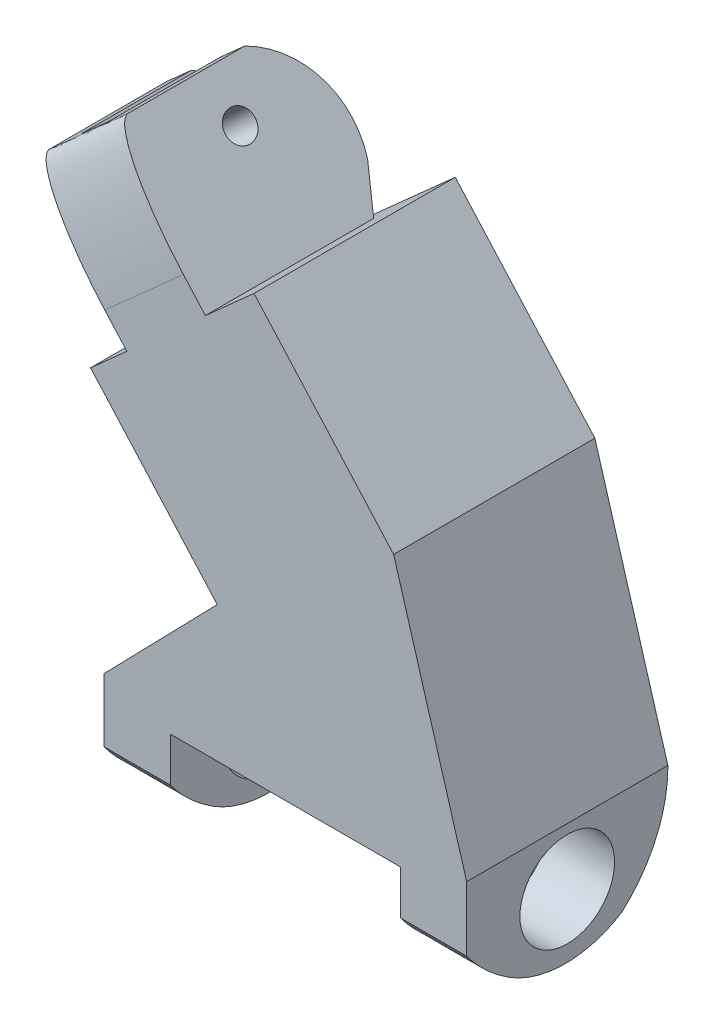
from build123d import *

# Parameters (mm, degrees)
BOSS_EXTRUDE1_DEPTH           = 17
CUT_EXTRUDE2_DEPTH            = 35
CUT_EXTRUDE3_DEPTH            = 30.5
CUT_EXTRUDE4_DEPTH            = 61
SKETCH6_R                     = 4
CUT_EXTRUDE5_DEPTH            = 61
CUT_EXTRUDE6_START            = -12.79
SKETCH7_W                     = 3.3
SKETCH7_H                     = 14.201279548
CUT_EXTRUDE6_DEPTH            = 12.79
SKETCH8_R                     = 1.25
CUT_EXTRUDE7_DEPTH            = 61
SKETCH9_R                     = 2.25
SKETCH9_R_2                   = 1.25
EXTRUDE_THIN1_DEPTH           = 1.75
EXTRUDE_THIN1_TAPER           = -30
EXTRUDE_THIN1_OTHER_WAY_DEPTH = 1.75
EXTRUDE_THIN1_OTHER_WAY_TAPER = -30
SKETCH10_R                    = 1.25
CUT_EXTRUDE9_DEPTH            = 43.000727623
FILLET1_SIZE                  = 10
FILLET1_SIZE_2                = 2


with BuildPart() as part:
    # Sketch1 → Boss-Extrude1 (new body)
    with BuildSketch(Plane.XY):
        Polygon((0, 0), (-11.797217655, 13.195289144), (-15.907217655, 9.520753176), (-24.431873803, 19.055654202), (-31.066793203, 13.123719901), (-22.542137055, 3.588818875), (-25.606127924, 0.849464945), (-14.904077823, -11.120869896), (-24.464229858, -20.947751043), (-24.464229858, -31.437751043), (-18.864229858, -31.437751043), (-18.864229858, -22.577751043), (0.565770142, -22.577751043), (0.565770142, -31.437751043), (6.165770142, -31.437751043), (6.165770142, -20.857751043), align=None)
    extrude(amount=BOSS_EXTRUDE1_DEPTH)

    # Sketch3 → Cut-Extrude2 (cut)
    with BuildSketch(Plane(origin=(-4.11, -3.674535968, 0), x_dir=(0, 0, -1), z_dir=(0.7454965618132088, 0.6665094720442348, 0))):
        with BuildLine():
            Line((-1.11054508, 20.98073524), (-2.78, 17.7))
            Line((-2.78, 17.7), (0.68, 17.7))
            Line((0.68, 17.7), (0.68, 32.569121824))
            Line((0.68, 32.569121824), (-17, 32.569121824))
            Line((-17, 32.569121824), (-17, 30.49))
            Line((-17, 30.49), (-5.15, 30.49))
            ThreePointArc((-5.15, 30.49), (-1.285745078, 26.518907223), (-1.11054508, 20.98073524))
        make_face()
    extrude(amount=-CUT_EXTRUDE2_DEPTH, mode=Mode.SUBTRACT)

    # Sketch4 → Cut-Extrude3 (cut, symmetric)
    with BuildSketch(Plane(origin=(-18.864229858, 0, 0), x_dir=(0, 0, -1), z_dir=(1, 0, 0))):
        with BuildLine():
            Line((-17, -26.307751043), (-17, -22.577751043))
            Line((-17, -22.577751043), (-18.338911285, -22.577751043))
            Line((-18.338911285, -22.577751043), (-18.338911285, -32.309712135))
            Line((-18.338911285, -32.309712135), (1.137649959, -32.309712135))
            Line((1.137649959, -32.309712135), (1.137649959, -22.577751043))
            Line((1.137649959, -22.577751043), (0, -22.577751043))
            Line((0, -22.577751043), (0, -29.657751043))
            Line((0, -29.657751043), (-3.9, -29.657751043))
            ThreePointArc((-3.9, -29.657751043), (-8.65, -31.031297694), (-13.4, -29.657751043))
            add(Edge.make_bspline(
                [(-13.4, -29.657751043), (-15.541480272, -28.298487281), (-17, -26.307751043)],
                knots=[0, 0, 0, 1, 1, 1], degree=2))
        make_face()
    extrude(amount=CUT_EXTRUDE3_DEPTH, both=True, mode=Mode.SUBTRACT)

    # Sketch5 → Cut-Extrude4 (cut)
    with BuildSketch(Plane.ZY.offset(-0.565770142)):
        with BuildLine():
            Line((3.9, -29.657751043), (0, -29.657751043))
            Line((0, -29.657751043), (0, -20.947751043))
            ThreePointArc((0, -20.947751043), (1.01950945, -25.719388602), (3.9, -29.657751043))
        make_face()
    extrude(amount=-CUT_EXTRUDE4_DEPTH, mode=Mode.SUBTRACT)

    # Sketch6 → Cut-Extrude5 (cut)
    with BuildSketch(Plane.ZY.offset(24.464229858)):
        with Locations(Location((8.5, -25.657751043, 0), (0, 0, 270))):
            Circle(SKETCH6_R)
    extrude(amount=-CUT_EXTRUDE5_DEPTH, mode=Mode.SUBTRACT)

    # Sketch7 → Cut-Extrude6 (cut)
    with BuildSketch(Plane(origin=(-20.321873803, 22.73019017, 0), x_dir=(0.7454965618132092, 0.6665094720442343, 0), z_dir=(-0.6665094720442343, 0.7454965618132092, 0)).offset(CUT_EXTRUDE6_START)):
        with Locations((-9.963103897, -7.399360226)):
            Rectangle(SKETCH7_W, SKETCH7_H)
    extrude(amount=CUT_EXTRUDE6_DEPTH, mode=Mode.SUBTRACT)

    # Sketch8 → Cut-Extrude7 (cut)
    with BuildSketch(Plane(origin=(-10.7449194, -9.606470269, 0), x_dir=(0, 0, 1), z_dir=(-0.7454965618132091, -0.6665094720442345, 0))):
        with Locations(Location((8.2, 26.49, 0), (0, 0, 270))):
            Circle(SKETCH8_R)
    extrude(amount=-CUT_EXTRUDE7_DEPTH, mode=Mode.SUBTRACT)

    # Sketch9 → Extrude-Thin1 (add)
    with BuildSketch(Plane(origin=(-7.4274597, -6.640503118, 0), x_dir=(0, 0, 1), z_dir=(-0.7454965618132092, -0.6665094720442343, 0))):
        with Locations((8.2, 26.49)):
            Circle(SKETCH9_R)
        with Locations((8.2, 26.49)):
            Circle(SKETCH9_R_2, mode=Mode.SUBTRACT)
    extrude(amount=EXTRUDE_THIN1_DEPTH, taper=EXTRUDE_THIN1_TAPER)

    # Sketch9 → Extrude-Thin1 other way (add)
    with BuildSketch(Plane(origin=(-7.4274597, -6.640503118, 0), x_dir=(0, 0, 1), z_dir=(-0.7454965618132092, -0.6665094720442343, 0))):
        with Locations((8.2, 26.49)):
            Circle(SKETCH9_R)
        with Locations((8.2, 26.49)):
            Circle(SKETCH9_R_2, mode=Mode.SUBTRACT)
    extrude(amount=-EXTRUDE_THIN1_OTHER_WAY_DEPTH, taper=EXTRUDE_THIN1_OTHER_WAY_TAPER)

    # Sketch10 → Cut-Extrude9 (cut, through all)
    with BuildSketch(Plane(origin=(-4.11, -3.674535968, 0), x_dir=(0, 0, -1), z_dir=(0.7454965618132088, 0.6665094720442348, 0))):
        with Locations(Location((-8.2, 26.49, 0), (0, 0, 270))):
            Circle(SKETCH10_R)
    extrude(amount=-CUT_EXTRUDE9_DEPTH, mode=Mode.SUBTRACT)

    # Fillet1
    # an asymmetric fillet: 10, 2 mm, written as the material it takes off along each edge
    with BuildSketch(Plane(origin=(-5.794459757, 35.718391003, 17), x_dir=(0.6665094720442343, -0.7454965618132092, 0), z_dir=(-0.7454965618132092, -0.6665094720442343, 0))) as fillet1_piece_1:
        with BuildLine():
            Bezier((FILLET1_SIZE, 0), (0, 0), (0, -FILLET1_SIZE_2), weights=[1, 0.707106781, 1])
            Line((0, -FILLET1_SIZE_2), (0, 0))
            Line((0, 0), (FILLET1_SIZE, 0))
        make_face()
    extrude(amount=58.9, mode=Mode.SUBTRACT)


solid = part.part
